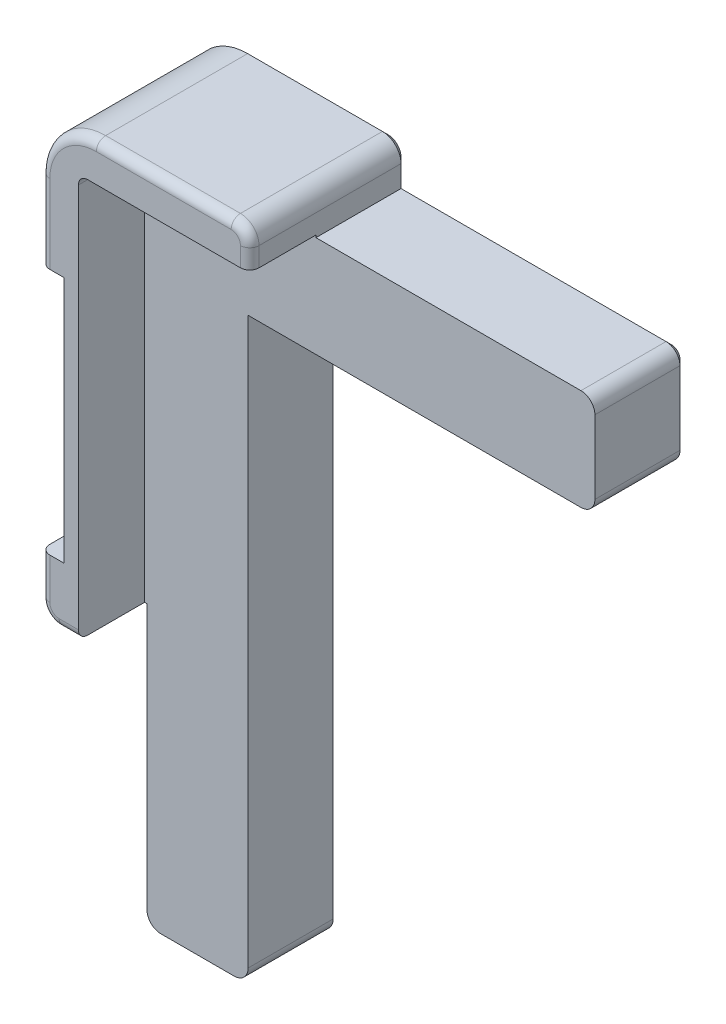
from build123d import *

# Parameters (mm, degrees)
BODY_AND_TONGUES_DEPTH     = 4.875
RIM_DEPTH                  = 8.435
BRACKET_SEAT_SKETCH_W      = 3.5
BRACKET_SEAT_SKETCH_H      = 26.6
BRACKET_SEAT_DEPTH         = 9.435
SCREW_PILOTS_SKETCH_R      = 2.15
SCREW_PILOTS_DEPTH         = 4.5
BUMPER_CORNER_R            = 6
INSIDE_CORNER_OF_THE_RIM_R = 1
RIM_ENDS_R                 = 2
TONGUE_LEAD_IN_R           = 1.5
RIM_TOP_EDGE_R             = 1
BED_FACE_CHAMFER_SIZE      = 0.6


with BuildPart() as part:
    # body and tongues sketch → body and tongues (new, symmetric)
    with BuildSketch(Plane.XY.offset(20.375)):
        Polygon((-4.42, 7.07), (18.08, 7.07), (18.08, 2.75), (48.08, 2.75), (48.08, -8.13), (10.78, -8.13), (10.78, -70.43), (-0.1, -70.43), (-0.1, -40.43), (-4.42, -40.43), align=None)
    extrude(amount=BODY_AND_TONGUES_DEPTH, both=True)

    # rim sketch → rim (add, symmetric)
    with BuildSketch(Plane.XY.offset(23.935)):
        Polygon((-4.42, 7.07), (18.08, 7.07), (18.08, 3), (-0.35, 3), (-0.35, -40.43), (-4.42, -40.43), align=None)
    extrude(amount=RIM_DEPTH, both=True)

    # bracket seat sketch → bracket seat (cut, symmetric)
    with BuildSketch(Plane.XY.offset(23.935)):
        with Locations((-3.67, -20.7)):
            Rectangle(BRACKET_SEAT_SKETCH_W, BRACKET_SEAT_SKETCH_H)
    extrude(amount=BRACKET_SEAT_DEPTH, both=True, mode=Mode.SUBTRACT)

    # screw pilots sketch → screw pilots (cut, symmetric)
    with BuildSketch(Plane(origin=(1.58, 0, 0), x_dir=(0, 0, -1), z_dir=(1, 0, 0))):
        with Locations((-20.375, -28.7)):
            Circle(SCREW_PILOTS_SKETCH_R)
        with Locations((-20.375, -12.7)):
            Circle(SCREW_PILOTS_SKETCH_R)
    extrude(amount=SCREW_PILOTS_DEPTH, both=True, mode=Mode.SUBTRACT)

    # bumper corner
    bumper_corner_edges = [part.edges().sort_by_distance(p)[0] for p in [
        (-4.42, 7.07, 23.935),
    ]]
    fillet(bumper_corner_edges, radius=BUMPER_CORNER_R)

    # inside corner of the rim
    inside_corner_of_the_rim_edges = [part.edges().sort_by_distance(p)[0] for p in [
        (-0.35, 3, 28.81),
    ]]
    fillet(inside_corner_of_the_rim_edges, radius=INSIDE_CORNER_OF_THE_RIM_R)

    # rim ends
    rim_ends_edges = [part.edges().sort_by_distance(p)[0] for p in [
        (18.08, 7.07, 23.935),
        (-4.42, -40.43, 23.935),
    ]]
    fillet(rim_ends_edges, radius=RIM_ENDS_R)

    # tongue lead-in
    tongue_lead_in_edges = [part.edges().sort_by_distance(p)[0] for p in [
        (48.08, -8.13, 20.375),
        (48.08, 2.75, 20.375),
        (10.78, -70.43, 20.375),
        (-0.1, -70.43, 20.375),
    ]]
    fillet(tongue_lead_in_edges, radius=TONGUE_LEAD_IN_R)

    # rim top edge
    rim_top_edge_edges = [part.edges().sort_by_distance(p)[0] for p in [
        (18.08, 4.035, 32.37),
        (17.494213562, 6.484213562, 32.37),
        (-4.42, -3.165, 32.37),
        (-2.662640687, 5.312640687, 32.37),
        (-1.385, -40.43, 32.37),
        (-3.834213562, -39.844213562, 32.37),
        (8.83, 7.07, 32.37),
        (-4.42, -36.215, 32.37),
    ]]
    fillet(rim_top_edge_edges, radius=RIM_TOP_EDGE_R)

    # bed face chamfer
    bed_face_chamfer_edges = [part.edges().sort_by_distance(p)[0] for p in [
        (47.640660172, 2.310660172, 15.5),
        (32.33, 2.75, 15.5),
        (18.08, 3.91, 15.5),
        (17.494213562, 6.484213562, 15.5),
        (8.83, 7.07, 15.5),
        (-2.662640687, 5.312640687, 15.5),
        (-4.42, -3.165, 15.5),
        (-3.17, -7.4, 15.5),
        (-1.92, -20.7, 15.5),
        (-3.17, -34, 15.5),
        (-4.42, -36.215, 15.5),
        (-3.834213562, -39.844213562, 15.5),
        (-1.26, -40.43, 15.5),
        (-0.1, -54.68, 15.5),
        (0.339339828, -69.990660172, 15.5),
        (5.34, -70.43, 15.5),
        (10.340660172, -69.990660172, 15.5),
        (10.78, -38.53, 15.5),
        (28.68, -8.13, 15.5),
        (47.640660172, -7.690660172, 15.5),
        (48.08, -2.69, 15.5),
    ]]
    chamfer(bed_face_chamfer_edges, length=BED_FACE_CHAMFER_SIZE)


solid = part.part
